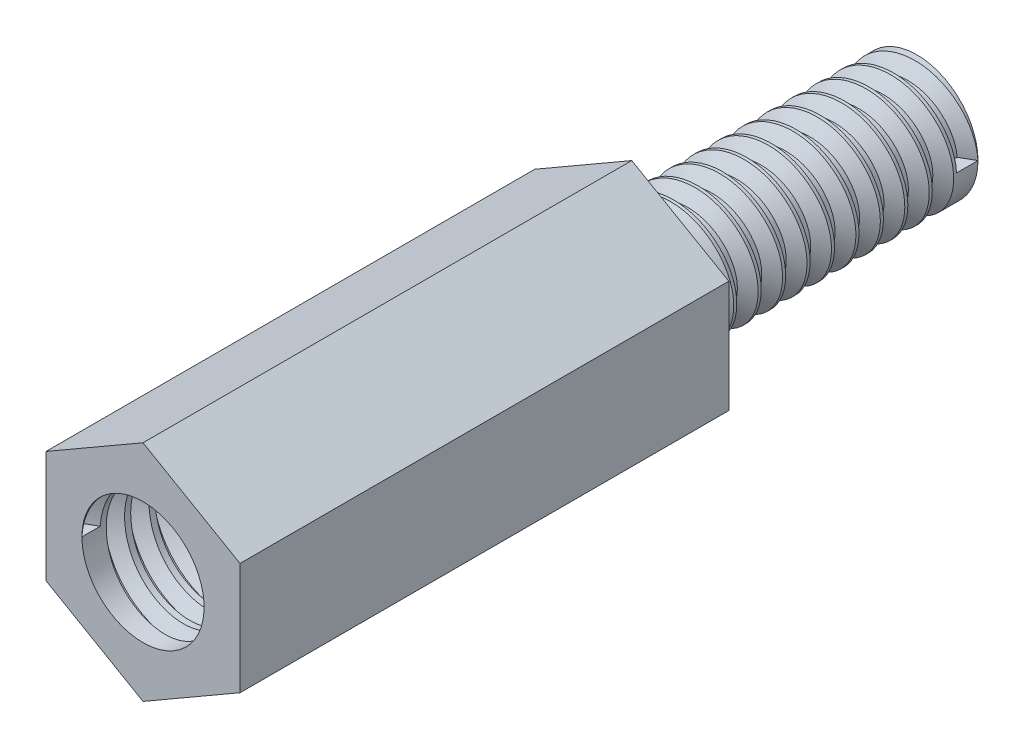
from build123d import *
from build123d.topology import SkipClean

# Parameters (mm, degrees)
BOSS_EXTRUDE1_DEPTH = 12
SKETCH2_R           = 1.5
CUT_EXTRUDE1_DEPTH  = 7
SKETCH3_R           = 1.5
BOSS_EXTRUDE2_DEPTH = 7
THREAD1_PITCH       = 0.6
THREAD2_PITCH       = 0.6


with BuildPart() as part:
    # Sketch1 → Boss-Extrude1 (new body)
    with BuildSketch(Plane.XY):
        Polygon((-2.38156986, -1.375), (0, -2.75), (2.38156986, -1.375), (2.38156986, 1.375), (0, 2.75), (-2.38156986, 1.375), align=None)
    extrude(amount=BOSS_EXTRUDE1_DEPTH)

    # Sketch2 → Cut-Extrude1 (cut)
    with BuildSketch(Plane.XY.offset(12)):
        Circle(SKETCH2_R)
    extrude(amount=-CUT_EXTRUDE1_DEPTH, mode=Mode.SUBTRACT)

    # Sketch3 → Boss-Extrude2 (add)
    with BuildSketch(Plane(origin=(0, 0, 0), x_dir=(-1, 0, 0), z_dir=(0, 0, -1))):
        with Locations(Location((0, 0, 0), (0, 0, 180))):
            Circle(SKETCH3_R)
    extrude(amount=BOSS_EXTRUDE2_DEPTH)

    # Thread1: the profile of Thread Profile1 profile screwed along a right-hand helix of 11.666667 turns, 6 arcs to a turn; built about Z, then put on its axis
    thread1_z = Axis((0, 0, 0), (0, 0, 1))
    thread1_corners = [(1.5003, 0, -0.000173205), (1.5003, 0, 0.525173203), (1.175240475, 0, 0.337499999), (1.175240475, 0, 0.187499999)]
    with BuildLine(mode=Mode.PRIVATE) as thread1_profile:
        Line(thread1_corners[0], thread1_corners[1])
        Line(thread1_corners[1], thread1_corners[2])
        Line(thread1_corners[2], thread1_corners[3])
        Line(thread1_corners[3], thread1_corners[0])
    thread1_cap = Face(thread1_profile.wire())
    thread1_turn_angles = [0, 30, 60, 90, 120, 150, 180, 210, 240, 270, 300, 330, 360]
    thread1_turn_weights = [1, 0.8660254037844387, 1, 0.8660254037844387, 1, 0.8660254037844387, 1, 0.8660254037844387, 1, 0.8660254037844387, 1, 0.8660254037844387, 1]
    thread1_turn_rails = [Edge.make_bspline([Vector(p[0], p[1], 0).rotate(thread1_z, thread1_turn_angles[k]) / thread1_turn_weights[k] + Vector(0, 0, p[2] + THREAD1_PITCH * thread1_turn_angles[k] / 360) for k in range(13)], [0, 0, 0, 1, 1, 2, 2, 3, 3, 4, 4, 5, 5, 6, 6, 6], 2, thread1_turn_weights) for p in thread1_corners]
    thread1_turn_sides = [Face.make_surface_from_curves(thread1_turn_rails[p[0]], thread1_turn_rails[p[1]]) for p in [(0, 1), (1, 2), (2, 3), (3, 0)]]
    thread1_last_angles = [3960, 3990, 4020, 4050, 4080, 4110, 4140, 4170, 4200]
    thread1_last_weights = [1, 0.8660254037844387, 1, 0.8660254037844387, 1, 0.8660254037844387, 1, 0.8660254037844387, 1]
    thread1_last_rails = [Edge.make_bspline([Vector(p[0], p[1], 0).rotate(thread1_z, thread1_last_angles[k]) / thread1_last_weights[k] + Vector(0, 0, p[2] + THREAD1_PITCH * thread1_last_angles[k] / 360) for k in range(9)], [0, 0, 0, 1, 1, 2, 2, 3, 3, 4, 4, 4], 2, thread1_last_weights) for p in thread1_corners]
    thread1_last_sides = [Face.make_surface_from_curves(thread1_last_rails[p[0]], thread1_last_rails[p[1]]) for p in [(0, 1), (1, 2), (2, 3), (3, 0)]]
    thread1 = Plane(origin=(0, 0, -7), x_dir=(1, 0, 0), z_dir=(0, 0, 1)) * Solid(Shell([*[p.moved(Location((0, 0, THREAD1_PITCH * i))) for i in range(11) for p in thread1_turn_sides], *thread1_last_sides, thread1_cap, thread1_cap.rotate(thread1_z, 4200).moved(Location((0, 0, THREAD1_PITCH * 4200 / 360)))]))
    add(thread1, mode=Mode.SUBTRACT)

    # Thread2: the profile of Thread Profile2 profile screwed along a right-hand helix of 11.666667 turns, 6 arcs to a turn; built about Z, then put on its axis
    with SkipClean():  # the faces are left unmerged after this step: merging them gives an invalid solid
        thread2_z = Axis((0, 0, 0), (0, 0, 1))
        thread2_corners = [(1.4997, 0, -0.000173205), (1.824759525, 0, 0.187499999), (1.824759525, 0, 0.262499999), (1.4997, 0, 0.450173203)]
        with BuildLine(mode=Mode.PRIVATE) as thread2_profile:
            Line(thread2_corners[0], thread2_corners[1])
            Line(thread2_corners[1], thread2_corners[2])
            Line(thread2_corners[2], thread2_corners[3])
            Line(thread2_corners[3], thread2_corners[0])
        thread2_cap = Face(thread2_profile.wire())
        thread2_turn_angles = [0, 30, 60, 90, 120, 150, 180, 210, 240, 270, 300, 330, 360]
        thread2_turn_weights = [1, 0.8660254037844387, 1, 0.8660254037844387, 1, 0.8660254037844387, 1, 0.8660254037844387, 1, 0.8660254037844387, 1, 0.8660254037844387, 1]
        thread2_turn_rails = [Edge.make_bspline([Vector(p[0], p[1], 0).rotate(thread2_z, thread2_turn_angles[k]) / thread2_turn_weights[k] + Vector(0, 0, p[2] + THREAD2_PITCH * thread2_turn_angles[k] / 360) for k in range(13)], [0, 0, 0, 1, 1, 2, 2, 3, 3, 4, 4, 5, 5, 6, 6, 6], 2, thread2_turn_weights) for p in thread2_corners]
        thread2_turn_sides = [Face.make_surface_from_curves(thread2_turn_rails[p[0]], thread2_turn_rails[p[1]]) for p in [(0, 1), (1, 2), (2, 3), (3, 0)]]
        thread2_last_angles = [3960, 3990, 4020, 4050, 4080, 4110, 4140, 4170, 4200]
        thread2_last_weights = [1, 0.8660254037844387, 1, 0.8660254037844387, 1, 0.8660254037844387, 1, 0.8660254037844387, 1]
        thread2_last_rails = [Edge.make_bspline([Vector(p[0], p[1], 0).rotate(thread2_z, thread2_last_angles[k]) / thread2_last_weights[k] + Vector(0, 0, p[2] + THREAD2_PITCH * thread2_last_angles[k] / 360) for k in range(9)], [0, 0, 0, 1, 1, 2, 2, 3, 3, 4, 4, 4], 2, thread2_last_weights) for p in thread2_corners]
        thread2_last_sides = [Face.make_surface_from_curves(thread2_last_rails[p[0]], thread2_last_rails[p[1]]) for p in [(0, 1), (1, 2), (2, 3), (3, 0)]]
        thread2 = Plane(origin=(0, 0, 12), x_dir=(-1, 0, 0), z_dir=(0, 0, -1)) * Solid(Shell([*[p.moved(Location((0, 0, THREAD2_PITCH * i))) for i in range(11) for p in thread2_turn_sides], *thread2_last_sides, thread2_cap, thread2_cap.rotate(thread2_z, 4200).moved(Location((0, 0, THREAD2_PITCH * 4200 / 360)))]))
        add(thread2, mode=Mode.SUBTRACT)


solid = part.part
